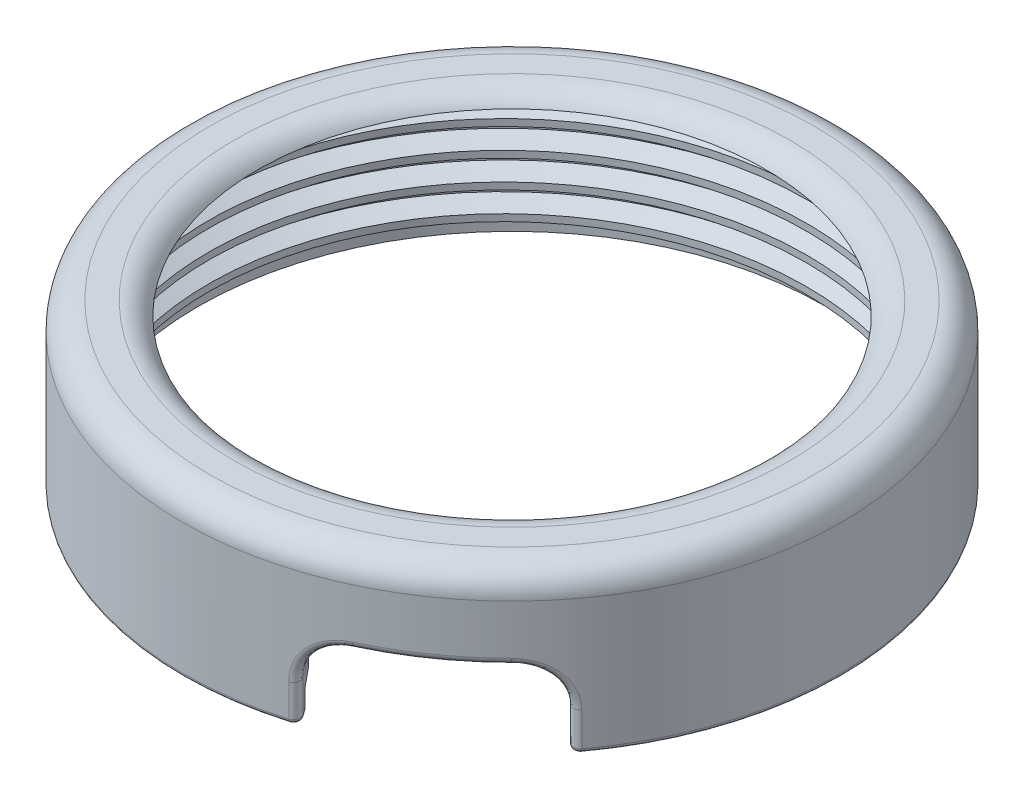
from build123d import *

# Parameters (mm, degrees)
SKETCH1_R           = 24
BOSS_EXTRUDE1_DEPTH = 11.8
CUT_EXTRUDE1_REACH  = 38.934
CUT_EXTRUDE1_START  = -1
SKETCH2_R           = 22.85
CUT_EXTRUDE2_REACH  = 37.934
SKETCH3_R           = 18.5
THREAD1_PITCH       = 2
SKETCH6_R           = 24
CUT_EXTRUDE3_DEPTH  = 2
FILLET1_R           = 2
FILLET2_R           = 2
CUT_EXTRUDE4_REACH  = 60.921
FILLET3_R           = 0.5
FILLET4_R           = 0.3


with BuildPart() as part:
    # Sketch1 → Boss-Extrude1 (new body)
    with BuildSketch(Plane(origin=(0, 0, 0), x_dir=(1, 0, 0), z_dir=(0, 1, 0))):
        with Locations(Location((0, 0, 0), (0, 0, 270))):
            Circle(SKETCH1_R)
    extrude(amount=BOSS_EXTRUDE1_DEPTH)

    # Sketch2 → Cut-Extrude1 (cut, up to next)
    with BuildSketch(Plane(origin=(0, 11.8, 0), x_dir=(1, 0, 0), z_dir=(0, 1, 0)).offset(CUT_EXTRUDE1_START), mode=Mode.PRIVATE) as cut_extrude1_sk1:
        with Locations(Location((0, 0, 0), (0, 0, 270))):
            Circle(SKETCH2_R)
    cut_extrude1_tool1 = extrude(cut_extrude1_sk1.sketch, amount=-CUT_EXTRUDE1_REACH, mode=Mode.PRIVATE) & part.part
    add(cut_extrude1_tool1.solids().sort_by_distance((0, 10.8, 0))[0], mode=Mode.SUBTRACT)

    # Sketch3 → Cut-Extrude2 (cut, up to next)
    with BuildSketch(Plane(origin=(0, 11.8, 0), x_dir=(1, 0, 0), z_dir=(0, 1, 0)), mode=Mode.PRIVATE) as cut_extrude2_sk1:
        with Locations(Location((0, 0, 0), (0, 0, 270))):
            Circle(SKETCH3_R)
    cut_extrude2_tool1 = extrude(cut_extrude2_sk1.sketch, amount=-CUT_EXTRUDE2_REACH, mode=Mode.PRIVATE) & part.part
    add(cut_extrude2_tool1.solids().sort_by_distance((0, 11.8, 0))[0], mode=Mode.SUBTRACT)

    # Thread1: the profile of Thread Profile1 profile screwed along a right-hand helix of 5.4 turns, 10 arcs to a turn; built about Z, then put on its axis
    thread1_z = Axis((0, 0, 0), (0, 0, 1))
    thread1_corners = [(22.8503, 0, -0.000173205), (22.8503, 0, 1.7501732), (21.76746825, 0, 1.124999997), (21.76746825, 0, 0.624999997)]
    with BuildLine(mode=Mode.PRIVATE) as thread1_profile:
        Line(thread1_corners[0], thread1_corners[1])
        Line(thread1_corners[1], thread1_corners[2])
        Line(thread1_corners[2], thread1_corners[3])
        Line(thread1_corners[3], thread1_corners[0])
    thread1_cap = Face(thread1_profile.wire())
    thread1_turn_angles = [0, 18, 36, 54, 72, 90, 108, 126, 144, 162, 180, 198, 216, 234, 252, 270, 288, 306, 324, 342, 360]
    thread1_turn_weights = [1, 0.9510565162951535, 1, 0.9510565162951535, 1, 0.9510565162951535, 1, 0.9510565162951535, 1, 0.9510565162951535, 1, 0.9510565162951535, 1, 0.9510565162951535, 1, 0.9510565162951535, 1, 0.9510565162951535, 1, 0.9510565162951535, 1]
    thread1_turn_rails = [Edge.make_bspline([Vector(p[0], p[1], 0).rotate(thread1_z, thread1_turn_angles[k]) / thread1_turn_weights[k] + Vector(0, 0, p[2] + THREAD1_PITCH * thread1_turn_angles[k] / 360) for k in range(21)], [0, 0, 0, 1, 1, 2, 2, 3, 3, 4, 4, 5, 5, 6, 6, 7, 7, 8, 8, 9, 9, 10, 10, 10], 2, thread1_turn_weights) for p in thread1_corners]
    thread1_turn_sides = [Face.make_surface_from_curves(thread1_turn_rails[p[0]], thread1_turn_rails[p[1]]) for p in [(0, 1), (1, 2), (2, 3), (3, 0)]]
    thread1_last_angles = [1800, 1818, 1836, 1854, 1872, 1890, 1908, 1926, 1944]
    thread1_last_weights = [1, 0.9510565162951535, 1, 0.9510565162951535, 1, 0.9510565162951535, 1, 0.951056516295153, 1]
    thread1_last_rails = [Edge.make_bspline([Vector(p[0], p[1], 0).rotate(thread1_z, thread1_last_angles[k]) / thread1_last_weights[k] + Vector(0, 0, p[2] + THREAD1_PITCH * thread1_last_angles[k] / 360) for k in range(9)], [0, 0, 0, 1, 1, 2, 2, 3, 3, 4, 4, 4], 2, thread1_last_weights) for p in thread1_corners]
    thread1_last_sides = [Face.make_surface_from_curves(thread1_last_rails[p[0]], thread1_last_rails[p[1]]) for p in [(0, 1), (1, 2), (2, 3), (3, 0)]]
    thread1 = Plane(origin=(0, 0, 0), x_dir=(1, 0, 0), z_dir=(0, 1, 0)) * Solid(Shell([*[p.moved(Location((0, 0, THREAD1_PITCH * i))) for i in range(5) for p in thread1_turn_sides], *thread1_last_sides, thread1_cap, thread1_cap.rotate(thread1_z, 1944).moved(Location((0, 0, THREAD1_PITCH * 1944 / 360)))]))
    add(thread1)

    # Sketch6 → Cut-Extrude3 (cut)
    with BuildSketch(Plane(origin=(0, 11.8, 0), x_dir=(1, 0, 0), z_dir=(0, 1, 0))):
        with Locations(Location((0, 0, 0), (0, 0, 270))):
            Circle(SKETCH6_R)
    extrude(amount=CUT_EXTRUDE3_DEPTH, mode=Mode.SUBTRACT)

    # Fillet1
    fillet1_edges = [part.edges().sort_by_distance(p)[0] for p in [
        (0, 11.8, -24),
    ]]
    fillet(fillet1_edges, radius=FILLET1_R)

    # Fillet2
    # the kernel refuses this fillet: 2 mm, written as the material it takes off along each edge
    with BuildSketch(Plane(origin=(0, 11.8, 0), x_dir=(0, 0, 1), z_dir=(-1, 0, 0))) as fillet2_piece_1:
        with BuildLine():
            CenterArc((20.232050808, -2), FILLET2_R, 90, 60)
            Line((18.5, -1), (18.465358984, -0.98))
            ThreePointArc((18.465358984, -0.98), (18.46, -0.5), (18.46, 0))
            Line((18.46, 0), (18.5, 0.04))
            Line((18.5, 0.04), (20.232050808, 0.04))
            Line((20.232050808, 0.04), (20.232050808, 0))
        make_face()
    revolve(axis=Axis((0, 11.8, 0), (0, 1, 0)), mode=Mode.SUBTRACT)

    # Sketch9 → Cut-Extrude4 (cut, up to next)
    with BuildSketch(Plane(origin=(13.765834472, 0, 19.659649063), x_dir=(0, -1, 0), z_dir=(-0.5735764363510444, 0, -0.819152044288993)), mode=Mode.PRIVATE) as cut_extrude4_sk1:
        with BuildLine():
            Line((0, -7), (0, 7))
            Line((0, 7), (-2.64, 7))
            ThreePointArc((-2.64, 7), (-4.796704668, 6.176551502), (-5.7, 4.052051561))
            Line((-5.7, 4.052051561), (-5.7, -4.05))
            ThreePointArc((-5.7, -4.05), (-4.835965005, -6.135965005), (-2.75, -7))
            Line((-2.75, -7), (0, -7))
        make_face()
    cut_extrude4_tool1 = extrude(cut_extrude4_sk1.sketch, amount=CUT_EXTRUDE4_REACH, mode=Mode.PRIVATE) & part.part
    add(cut_extrude4_tool1.solids().sort_by_distance((13.765408, 2.742526, 19.659948))[0], mode=Mode.SUBTRACT)

    # Fillet3
    fillet3_edges = [part.edges().sort_by_distance(p)[0] for p in [
        (18.901360625, 1.375, 14.789812931),
        (7.433232004, 1.32, 22.81988304),
        (8.25240176, 4.807102739, 22.536589474),
        (13.764981957, 5.7, 19.660245973),
        (18.328219433, 4.84550935, 15.4943981),
    ]]
    fillet(fillet3_edges, radius=FILLET3_R)

    # Fillet4
    fillet4_edges = [part.edges().sort_by_distance(p)[0] for p in [
        (-10.823204028, 0, -21.420976975),
        (18.911735616, 0, 14.441522261),
        (7.102397375, 0, 22.710509918),
        (18.359180496, 0, 14.015499462),
        (6.891051876, 0, 22.04556957),
    ]]
    fillet(fillet4_edges, radius=FILLET4_R)


solid = part.part
